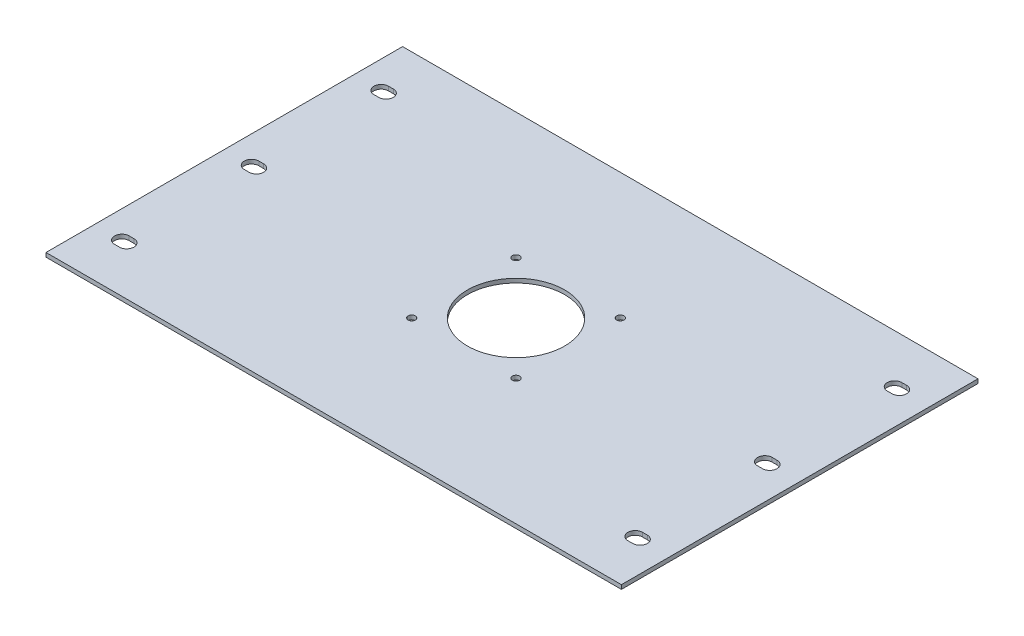
from build123d import *

# Parameters (mm, degrees)
SKETCH1_W                = 355
SKETCH1_H                = 100
BOSS_EXTRUDE1_DEPTH      = 2.54
SKETCH4_R                = 2.25
SKETCH4_R_2              = 30
CUT_EXTRUDE1_DEPTH       = 2.54
SKETCH5_W                = 100
SKETCH5_H                = 2.54
BOSS_EXTRUDE2_DEPTH      = 2.5
SKETCH6_W                = 100
SKETCH6_H                = 2.54
CUT_EXTRUDE2_DEPTH       = 2.5
SKETCH7_W                = 355
SKETCH7_H                = 2.54
BOSS_EXTRUDE3_DEPTH      = 60
SKETCH8_W                = 355
SKETCH8_H                = 2.54
BOSS_EXTRUDE4_DEPTH      = 60
M8_CLEARANCE_SLOT6_DEPTH = 2.54


# Read off the part's stored shape, not the designer's step: M8 Clearance Slot6
with BuildPart() as part:
    # Sketch1 → Boss-Extrude1 (new body)
    with BuildSketch(Plane(origin=(0, 0, 0), x_dir=(1, 0, 0), z_dir=(0, 1, 0))):
        with Locations((-6.378176495, -11.509617782)):
            Rectangle(SKETCH1_W, SKETCH1_H)
    extrude(amount=BOSS_EXTRUDE1_DEPTH)

    # Sketch4 → Cut-Extrude1 (cut)
    with BuildSketch(Plane(origin=(0, 0, 0), x_dir=(-1, 0, 0), z_dir=(0, -1, 0))):
        with Locations(Location((38.553176495, 20.665382218, 0), (0, 0, 90))):
            Circle(SKETCH4_R)
        with Locations(Location((-25.796823505, 20.665382218, 0), (0, 0, 90))):
            Circle(SKETCH4_R)
        with Locations(Location((-25.796823505, -43.684617782, 0), (0, 0, 90))):
            Circle(SKETCH4_R)
        with Locations(Location((38.553176495, -43.684617782, 0), (0, 0, 90))):
            Circle(SKETCH4_R)
        with Locations(Location((6.378176495, -11.509617782, 0), (0, 0, 90))):
            Circle(SKETCH4_R_2)
    extrude(amount=-CUT_EXTRUDE1_DEPTH, mode=Mode.SUBTRACT)

    # Sketch5 → Boss-Extrude2 (add)
    with BuildSketch(Plane.ZY.offset(183.878176495)):
        with Locations((11.509617782, 1.27)):
            Rectangle(SKETCH5_W, SKETCH5_H)
    extrude(amount=BOSS_EXTRUDE2_DEPTH)

    # Sketch6 → Cut-Extrude2 (cut)
    with BuildSketch(Plane(origin=(171.121823505, 0, 0), x_dir=(0, 0, -1), z_dir=(1, 0, 0))):
        with Locations((-11.509617782, 1.27)):
            Rectangle(SKETCH6_W, SKETCH6_H)
    extrude(amount=-CUT_EXTRUDE2_DEPTH, mode=Mode.SUBTRACT)

    # Sketch7 → Boss-Extrude3 (add)
    with BuildSketch(Plane(origin=(0, 0, -38.490382218), x_dir=(-1, 0, 0), z_dir=(0, 0, -1))):
        with Locations((8.878176495, 1.27)):
            Rectangle(SKETCH7_W, SKETCH7_H)
    extrude(amount=BOSS_EXTRUDE3_DEPTH)

    # Sketch8 → Boss-Extrude4 (add)
    with BuildSketch(Plane.XY.offset(61.509617782)):
        with Locations((-8.878176495, 1.27)):
            Rectangle(SKETCH8_W, SKETCH8_H)
    extrude(amount=BOSS_EXTRUDE4_DEPTH)

    # M8 Clearance Slot6 outline → M8 Clearance Slot6 (cut)
    with BuildSketch(Plane(origin=(0, 0, 0), x_dir=(1, 0, 0), z_dir=(0, 1, 0))):
        with BuildLine():
            Line((-169.579279891, 63.990382218), (-166.579279891, 63.990382218))
            ThreePointArc((-166.579279891, 63.990382218), (-162.079279891, 68.490382218), (-166.579279891, 72.990382218))
            Line((-166.579279891, 72.990382218), (-169.579279891, 72.990382218))
            ThreePointArc((-169.579279891, 72.990382218), (-174.079279891, 68.490382218), (-169.579279891, 63.990382218))
        make_face()
        with BuildLine():
            ThreePointArc((147.121823505, 72.990382218), (142.621823505, 68.490382218), (147.121823505, 63.990382218))
            Line((147.121823505, 63.990382218), (150.121823505, 63.990382218))
            ThreePointArc((150.121823505, 63.990382218), (154.621823505, 68.490382218), (150.121823505, 72.990382218))
            Line((150.121823505, 72.990382218), (147.121823505, 72.990382218))
        make_face()
        with BuildLine():
            Line((-169.579279891, -96.009617782), (-166.579279891, -96.009617782))
            ThreePointArc((-166.579279891, -96.009617782), (-162.079279891, -91.509617782), (-166.579279891, -87.009617782))
            Line((-166.579279891, -87.009617782), (-169.579279891, -87.009617782))
            ThreePointArc((-169.579279891, -87.009617782), (-174.079279891, -91.509617782), (-169.579279891, -96.009617782))
        make_face()
        with BuildLine():
            ThreePointArc((150.121823505, -96.009617782), (154.621823505, -91.509617782), (150.121823505, -87.009617782))
            Line((150.121823505, -87.009617782), (147.121823505, -87.009617782))
            ThreePointArc((147.121823505, -87.009617782), (142.621823505, -91.509617782), (147.121823505, -96.009617782))
            Line((147.121823505, -96.009617782), (150.121823505, -96.009617782))
        make_face()
        with BuildLine():
            ThreePointArc((-166.579279891, -16.009617782), (-162.079279891, -11.509617782), (-166.579279891, -7.009617782))
            Line((-166.579279891, -7.009617782), (-169.579279891, -7.009617782))
            ThreePointArc((-169.579279891, -7.009617782), (-174.079279891, -11.509617782), (-169.579279891, -16.009617782))
            Line((-169.579279891, -16.009617782), (-166.579279891, -16.009617782))
        make_face()
        with BuildLine():
            ThreePointArc((150.121823505, -16.009617782), (154.621823505, -11.509617782), (150.121823505, -7.009617782))
            Line((150.121823505, -7.009617782), (147.121823505, -7.009617782))
            ThreePointArc((147.121823505, -7.009617782), (142.621823505, -11.509617782), (147.121823505, -16.009617782))
            Line((147.121823505, -16.009617782), (150.121823505, -16.009617782))
        make_face()
    extrude(amount=M8_CLEARANCE_SLOT6_DEPTH, mode=Mode.SUBTRACT)


solid = part.part
